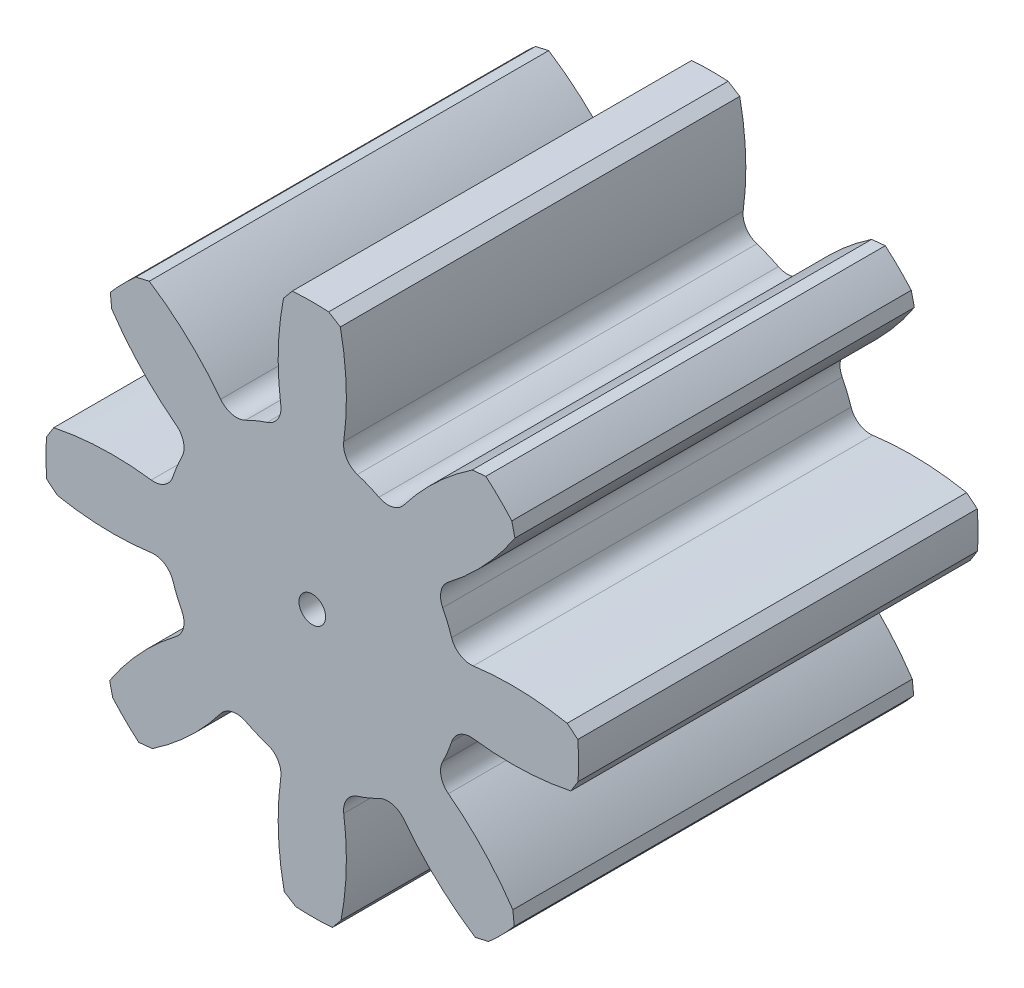
from build123d import *

# Parameters (mm, degrees)
SKETCH1_R           = 0.5
BOSS_EXTRUDE1_DEPTH = 15
FILLET1_R           = 0.75


with BuildPart() as part:
    # Sketch1 → Boss-Extrude1 (new body)
    with BuildSketch(Plane.XY):
        with BuildLine():
            ThreePointArc((9.949874371, -1), (10, 0), (9.949874371, 1))
            ThreePointArc((9.949874371, 1), (7.675986954, 1.279279491), (5.394319042, 1.072996771))
            ThreePointArc((5.394319042, 1.072996771), (5.081337429, 2.104758878), (4.573082868, 3.055636282))
            ThreePointArc((4.573082868, 3.055636282), (6.332329631, 4.523155224), (7.742730421, 6.328516859))
            ThreePointArc((7.742730421, 6.328516859), (7.071067812, 7.071067812), (6.328516859, 7.742730421))
            ThreePointArc((6.328516859, 7.742730421), (4.523155224, 6.332329631), (3.055636282, 4.573082868))
            ThreePointArc((3.055636282, 4.573082868), (2.104758878, 5.081337429), (1.072996771, 5.394319042))
            ThreePointArc((1.072996771, 5.394319042), (1.279279491, 7.675986954), (1, 9.949874371))
            ThreePointArc((1, 9.949874371), (0, 10), (-1, 9.949874371))
            ThreePointArc((-1, 9.949874371), (-1.279279491, 7.675986954), (-1.072996771, 5.394319042))
            ThreePointArc((-1.072996771, 5.394319042), (-2.104758878, 5.081337429), (-3.055636282, 4.573082868))
            ThreePointArc((-3.055636282, 4.573082868), (-4.523155224, 6.332329631), (-6.328516859, 7.742730421))
            ThreePointArc((-6.328516859, 7.742730421), (-7.071067812, 7.071067812), (-7.742730421, 6.328516859))
            ThreePointArc((-7.742730421, 6.328516859), (-6.332329631, 4.523155224), (-4.573082868, 3.055636282))
            ThreePointArc((-4.573082868, 3.055636282), (-5.081337429, 2.104758878), (-5.394319042, 1.072996771))
            ThreePointArc((-5.394319042, 1.072996771), (-7.675986954, 1.279279491), (-9.949874371, 1))
            ThreePointArc((-9.949874371, 1), (-10, 0), (-9.949874371, -1))
            ThreePointArc((-9.949874371, -1), (-7.675986954, -1.279279491), (-5.394319042, -1.072996771))
            ThreePointArc((-5.394319042, -1.072996771), (-5.081337429, -2.104758878), (-4.573082868, -3.055636282))
            ThreePointArc((-4.573082868, -3.055636282), (-6.332329631, -4.523155224), (-7.742730421, -6.328516859))
            ThreePointArc((-7.742730421, -6.328516859), (-7.071067812, -7.071067812), (-6.328516859, -7.742730421))
            ThreePointArc((-6.328516859, -7.742730421), (-4.523155224, -6.332329631), (-3.055636282, -4.573082868))
            ThreePointArc((-3.055636282, -4.573082868), (-2.104758878, -5.081337429), (-1.072996771, -5.394319042))
            ThreePointArc((-1.072996771, -5.394319042), (-1.279279491, -7.675986954), (-1, -9.949874371))
            ThreePointArc((-1, -9.949874371), (0, -10), (1, -9.949874371))
            ThreePointArc((1, -9.949874371), (1.279279491, -7.675986954), (1.072996771, -5.394319042))
            ThreePointArc((1.072996771, -5.394319042), (2.104758878, -5.081337429), (3.055636282, -4.573082868))
            ThreePointArc((3.055636282, -4.573082868), (4.523155224, -6.332329631), (6.328516859, -7.742730421))
            ThreePointArc((6.328516859, -7.742730421), (7.071067812, -7.071067812), (7.742730421, -6.328516859))
            ThreePointArc((7.742730421, -6.328516859), (6.332329631, -4.523155224), (4.573082868, -3.055636282))
            ThreePointArc((4.573082868, -3.055636282), (5.081337429, -2.104758878), (5.394319042, -1.072996771))
            ThreePointArc((5.394319042, -1.072996771), (7.675986954, -1.279279491), (9.949874371, -1))
        make_face()
        Circle(SKETCH1_R, mode=Mode.SUBTRACT)
    extrude(amount=BOSS_EXTRUDE1_DEPTH)

    # Fillet1
    fillet1_edges = [part.edges().sort_by_distance(p)[0] for p in [
        (-3.055636282, 4.573082868, 7.5),
        (-1.072996771, 5.394319042, 7.5),
        (1.072996771, 5.394319042, 7.5),
        (3.055636282, 4.573082868, 7.5),
        (4.573082868, 3.055636282, 7.5),
        (5.394319042, 1.072996771, 7.5),
        (5.394319042, -1.072996771, 7.5),
        (4.573082868, -3.055636282, 7.5),
        (3.055636282, -4.573082868, 7.5),
        (1.072996771, -5.394319042, 7.5),
        (-1.072996771, -5.394319042, 7.5),
        (-3.055636282, -4.573082868, 7.5),
        (-4.573082868, -3.055636282, 7.5),
        (-5.394319042, -1.072996771, 7.5),
        (-5.394319042, 1.072996771, 7.5),
        (-4.573082868, 3.055636282, 7.5),
    ]]
    fillet(fillet1_edges, radius=FILLET1_R)

    # Chamfer1
    # the kernel refuses this chamfer: 0.400753043, 0.25 mm, written as the material it takes off along each edge
    with BuildSketch(Plane(origin=(-1, 9.949874371, -1.002654566), x_dir=(-0.20895056645283513, -0.9779262041580844, 0), z_dir=(0, 0, 1)), Plane(origin=(-6.328516859, -7.742730421, -1.002654566), x_dir=(0.8392486129317811, 0.543747887988617, 0), z_dir=(0, 0, 1)), Plane(origin=(-9.949874371, -1, -1.002654566), x_dir=(0.9779262041580814, -0.20895056645284896, 0), z_dir=(0, 0, 1)), Plane(origin=(-7.742730421, 6.328516859, -1.002654566), x_dir=(0.5437478879886213, -0.8392486129317783, 0), z_dir=(0, 0, 1))) as chamfer1_piece_1:
        with BuildLine():
            Line((0.38673743, 0), (-0.072587978, 0.236060888))
            ThreePointArc((-0.072587978, 0.236060888), (-0.038665519, 0.123154019), (0, 0))
            ThreePointArc((0, 0), (0.200496166, -0.001727616), (0.38673743, 0))
        make_face()
    extrude(amount=17.005309131, mode=Mode.SUBTRACT)
    with BuildSketch(Plane(origin=(1, 9.949874371, -1.000017097), x_dir=(-0.9967308645828112, 0.08079346253256948, 0), z_dir=(0, 0, 1)), Plane(origin=(-7.742730421, -6.328516859, -1.000017097), x_dir=(0.6476655481321507, -0.761924758596727, 0), z_dir=(0, 0, 1)), Plane(origin=(-9.949874371, 1, -1.000017097), x_dir=(-0.0807934625325496, -0.9967308645828128, 0), z_dir=(0, 0, 1)), Plane(origin=(-6.328516859, 7.742730421, -1.000017097), x_dir=(-0.7619247585967629, -0.6476655481321085, 0), z_dir=(0, 0, 1))) as chamfer1_piece_2:
        with BuildLine():
            Line((0.385692125, 0), (-0.072539186, 0.236306293))
            ThreePointArc((-0.072539186, 0.236306293), (-0.038587076, 0.123299359), (0, 0))
            ThreePointArc((0, 0), (0.199968385, -0.001857117), (0.385692125, 0))
        make_face()
    extrude(amount=17.000034195, mode=Mode.SUBTRACT)
    with BuildSketch(Plane(origin=(6.328516859, 7.742730421, -1.002654566), x_dir=(0.7663992656604338, -0.6423645114692652, 0), z_dir=(0, 0, 1)), Plane(origin=(9.949874371, 1, -1.002654566), x_dir=(0.08770581579133363, -0.9961464198983886, 0), z_dir=(0, 0, 1)), Plane(origin=(7.742730421, -6.328516859, -1.002654566), x_dir=(-0.6423645114693267, -0.7663992656603822, 0), z_dir=(0, 0, 1)), Plane(origin=(1, -9.949874371, -1.002654566), x_dir=(-0.9961464198983921, -0.08770581579129355, 0), z_dir=(0, 0, 1))) as chamfer1_piece_3:
        with BuildLine():
            Line((0.246969142, 0), (-0.113667999, -0.36965582))
            ThreePointArc((-0.113667999, -0.36965582), (-0.060580175, -0.19113278), (0, 0))
            ThreePointArc((0, 0), (0.129078874, 0.000760886), (0.246969142, 0))
        make_face()
    extrude(amount=17.005309131, mode=Mode.SUBTRACT)
    with BuildSketch(Plane(origin=(7.742730421, 6.328516859, -1.000017097), x_dir=(-0.538317928460667, -0.8427418394133617, 0), z_dir=(0, 0, 1)), Plane(origin=(9.949874371, -1, -1.000017097), x_dir=(-0.9765567270876431, -0.215260211789988, 0), z_dir=(0, 0, 1)), Plane(origin=(6.328516859, -7.742730421, -1.000017097), x_dir=(-0.8427418394133621, 0.5383179284606663, 0), z_dir=(0, 0, 1)), Plane(origin=(-1, -9.949874371, -1.000017097), x_dir=(-0.21526021179000385, 0.9765567270876397, 0), z_dir=(0, 0, 1))) as chamfer1_piece_4:
        with BuildLine():
            Line((0.247189396, 0), (-0.113183628, -0.368711108))
            ThreePointArc((-0.113183628, -0.368711108), (-0.060457254, -0.190619318), (0, 0))
            ThreePointArc((0, 0), (0.129194415, 0.000705264), (0.247189396, 0))
        make_face()
    extrude(amount=17.000034195, mode=Mode.SUBTRACT)


solid = part.part
